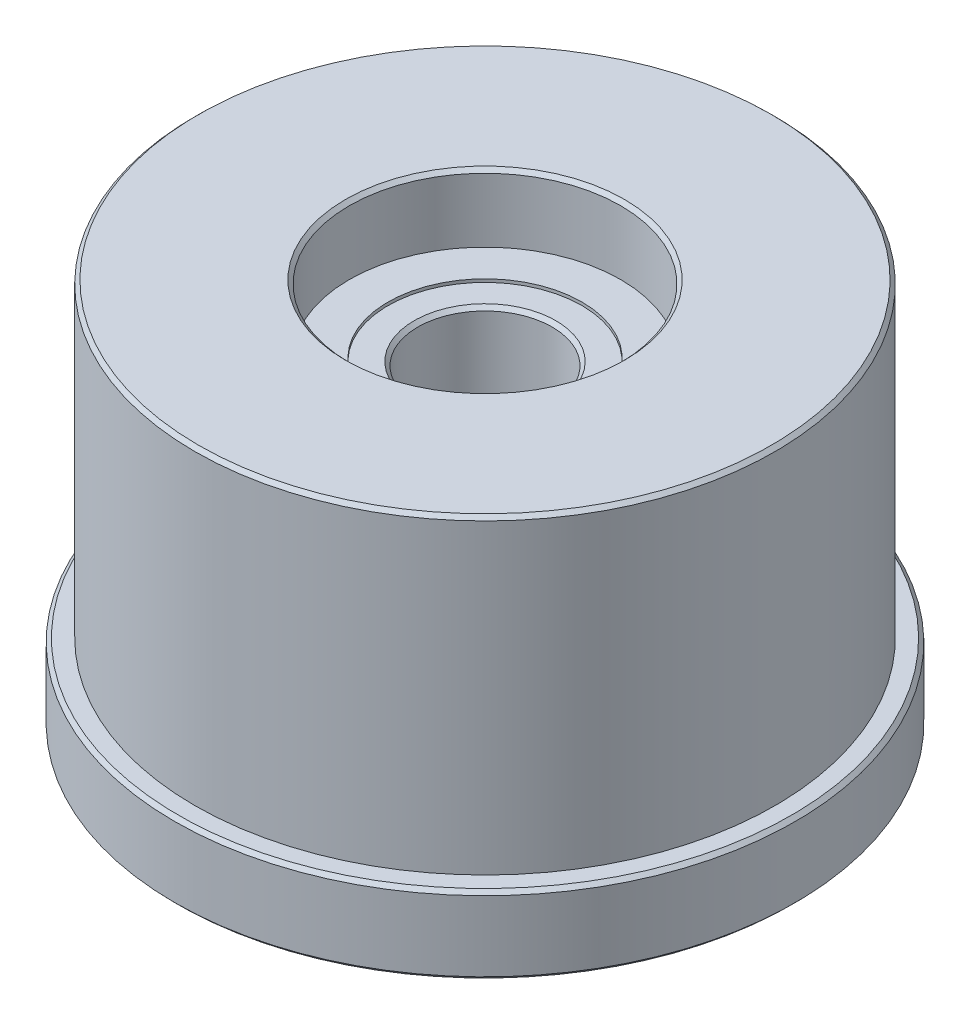
from build123d import *

# Parameters (mm, degrees)
SKETCH1_R           = 23.749
BOSS_EXTRUDE1_DEPTH = 25.4
SKETCH2_R           = 25.4
BOSS_EXTRUDE2_DEPTH = 6.35
SKETCH3_R           = 5.5
CUT_EXTRUDE1_DEPTH  = 48.941448664
SKETCH4_R           = 11.1125
CUT_EXTRUDE2_DEPTH  = 5.5372
SKETCH5_R           = 7.9375
CUT_EXTRUDE3_DEPTH  = 0.254
CHAMFER1_SIZE       = 0.299999908


with BuildPart() as part:
    # Sketch1 → Boss-Extrude1 (new body)
    with BuildSketch(Plane(origin=(0, 0, 0), x_dir=(1, 0, 0), z_dir=(0, 1, 0))):
        Circle(SKETCH1_R)
    extrude(amount=BOSS_EXTRUDE1_DEPTH)

    # Sketch2 → Boss-Extrude2 (add)
    with BuildSketch(Plane.XZ):
        Circle(SKETCH2_R)
    extrude(amount=BOSS_EXTRUDE2_DEPTH)

    # Sketch3 → Cut-Extrude1 (cut, through all)
    with BuildSketch(Plane.XZ.offset(6.35)):
        Circle(SKETCH3_R)
    extrude(amount=-CUT_EXTRUDE1_DEPTH, mode=Mode.SUBTRACT)

    # Sketch4 → Cut-Extrude2 (cut)
    with BuildSketch(Plane.XZ.offset(6.35)):
        Circle(SKETCH4_R)
    cut_extrude2 = extrude(amount=-CUT_EXTRUDE2_DEPTH, mode=Mode.SUBTRACT)

    # Sketch5 → Cut-Extrude3 (cut)
    with BuildSketch(Plane.XZ.offset(0.8128)):
        Circle(SKETCH5_R)
    cut_extrude3 = extrude(amount=-CUT_EXTRUDE3_DEPTH, mode=Mode.SUBTRACT)

    # Mirror1: Cut-Extrude2, Cut-Extrude3 across plane
    add(cut_extrude2.mirror(Plane.ZX.offset(9.525)), mode=Mode.SUBTRACT)
    add(cut_extrude3.mirror(Plane.ZX.offset(9.525)), mode=Mode.SUBTRACT)

    # Chamfer1
    chamfer1_edges = [part.edges().sort_by_distance(p)[0] for p in [
        (-25.4, 0, 0),
        (-25.4, -6.35, 0),
        (-11.1125, -6.35, 0),
        (-23.749, 25.4, 0),
        (-5.5, 19.6088, 0),
        (-5.5, -0.5588, 0),
        (-11.1125, 25.4, 0),
    ]]
    chamfer(chamfer1_edges, length=CHAMFER1_SIZE)


solid = part.part
